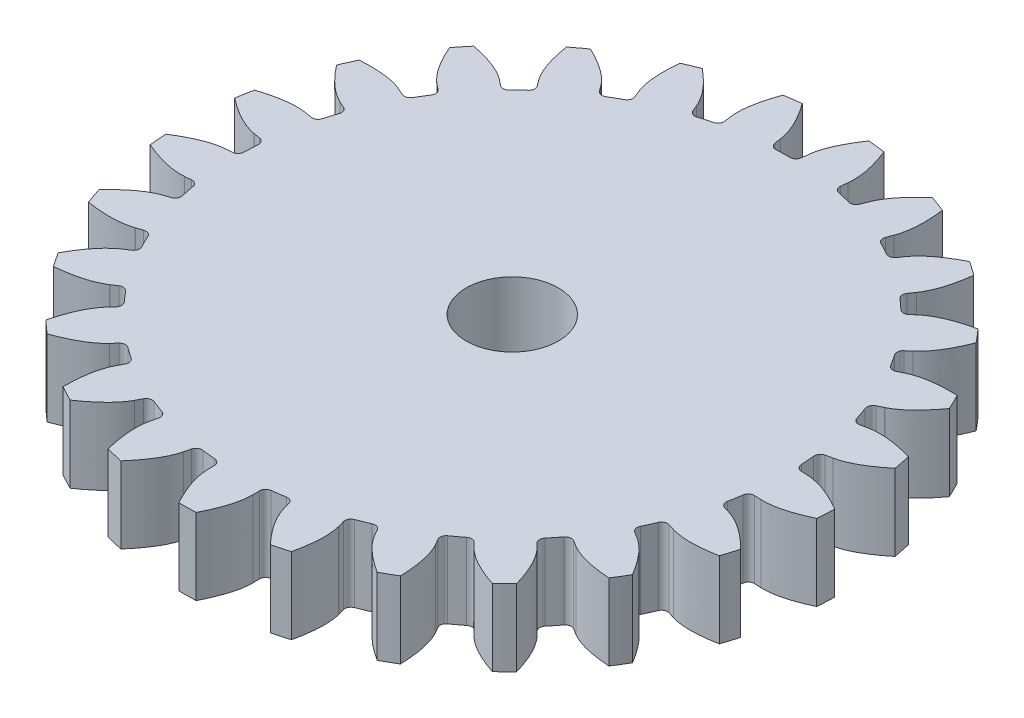
from build123d import *

# Parameters (mm, degrees)
BOSS_EXTRUDE2_DEPTH = 10
CIRPATTERN1_COUNT   = 25
SKETCH3_R           = 6.04294198
CUT_EXTRUDE1_DEPTH  = 10
FILLET1_R           = 0.8


with BuildPart() as part:
    # Sketch1 → Boss-Extrude2 (new body)
    with BuildSketch(Plane(origin=(0, 0, 0), x_dir=(1, 0, 0), z_dir=(0, 1, 0))):
        with BuildLine():
            add(Edge.make_bspline(
                [(26.633020463, 26.527161948), (26.749695792, 26.628801295), (26.879689147, 26.729652173), (27.012694679, 26.826141026), (27.020826293, 26.832015831)],
                knots=[0, 0, 0, 0, 0.040059088, 0.042663871, 0.042663871, 0.042663871, 0.042663871], degree=3))
            Line((26.633020463, 26.527161948), (25.4191383, 25.492497094))
            ThreePointArc((25.4191383, 25.492497094), (-27.397879726, -23.352862491), (29.197066656, 21.06018278))
            Line((29.197066656, 21.06018278), (30.410948819, 22.094847634))
            add(Edge.make_bspline(
                [(30.410948819, 22.094847634), (30.529786439, 22.193950153), (31.542274252, 23.14079114), (32.61415257, 24.887712007), (33.366991417, 26.583683765), (33.594353191, 27.159886482)],
                knots=[0, 0, 0, 0, 0.040059088, 0.359466749, 0.520253837, 0.520253837, 0.520253837, 0.520253837], degree=3))
            ThreePointArc((33.594353191, 27.159886482), (32.877455672, 28.023434989), (32.13836682, 28.868068487))
            add(Edge.make_bspline(
                [(32.13836682, 28.868068487), (31.533424415, 28.73484824), (29.749344528, 28.262732537), (28.009821823, 27.546530389), (27.020826293, 26.832015831)],
                knots=[0.188393437, 0.188393437, 0.188393437, 0.188393437, 0.349180525, 0.665983403, 0.665983403, 0.665983403, 0.665983403], degree=3))
        make_face()
    boss_extrude2 = extrude(amount=BOSS_EXTRUDE2_DEPTH)

    # CirPattern1: Boss-Extrude2 ×25 about axis
    cirpattern1_axis = Axis((0, 0, 0), (0, 1, 0))
    for i in range(1, CIRPATTERN1_COUNT):
        add(boss_extrude2.rotate(cirpattern1_axis, i * 360 / CIRPATTERN1_COUNT))

    # Sketch3 → Cut-Extrude1 (cut)
    with BuildSketch(Plane(origin=(0, 10, 0), x_dir=(1, 0, 0), z_dir=(0, 1, 0))):
        Circle(SKETCH3_R)
    extrude(amount=-CUT_EXTRUDE1_DEPTH, mode=Mode.SUBTRACT)

    # Fillet1
    fillet1_edges = [part.edges().sort_by_distance(p)[0] for p in [
        (23.960767775, 5, -28.963592796),
        (18.280823102, 5, -31.013086056),
        (19.199258239, 5, -32.317125229),
        (16.00504357, 5, -34.012448902),
        (9.993856557, 5, -34.585008763),
        (10.55913601, 5, -36.076484678),
        (7.043663615, 5, -36.924177755),
        (6.867058433, 5, -35.338980015),
        (1.078939249, 5, -35.983828175),
        (1.255544431, 5, -37.569025915),
        (-2.360295629, 5, -37.515824722),
        (-2.137129788, 5, -35.936508961),
        (-7.90377178, 5, -35.121651323),
        (-8.126937621, 5, -36.700967084),
        (-11.615948819, 5, -35.750214448),
        (-11.007034284, 5, -34.276014883),
        (-16.38985976, 5, -32.05265195),
        (-16.998774294, 5, -33.526851515),
        (-20.141729223, 5, -31.73828672),
        (-19.185326336, 5, -30.461832732),
        (-23.846112574, 5, -26.969666574),
        (-24.802515462, 5, -28.246120562),
        (-27.401930705, 5, -25.732125712),
        (-26.158133774, 5, -24.7336216),
        (-29.804026435, 5, -20.19207786),
        (-31.047823365, 5, -21.190581972),
        (-32.940368103, 5, -18.109120609),
        (-31.487329465, 5, -17.451306059),
        (-33.889243703, 5, -12.145746632),
        (-35.342282341, 5, -12.803561183),
        (-36.409041027, 5, -9.348252859),
        (-34.838060443, 5, -9.072460776),
        (-35.845075153, 5, -3.336253474),
        (-37.416055737, 5, -3.612045557),
        (-37.59, 5, 0),
        (-35.999787959, 5, -0.123559417),
        (-35.548628703, 5, 5.682868759),
        (-37.138840744, 5, 5.806428176),
        (-36.409041027, 5, 9.348252859),
        (-34.899516398, 5, 8.833105635),
        (-33.018531173, 5, 14.344915448),
        (-34.528055801, 5, 14.860062672),
        (-32.940368103, 5, 18.109120609),
        (-31.606379872, 5, 17.234754173),
        (-28.413757895, 5, 22.105618342),
        (-29.747746126, 5, 22.979984778),
        (-27.401930705, 5, 25.732125712),
        (-26.327298257, 5, 24.553479722),
        (-22.02364371, 5, 28.477343937),
        (-23.098276158, 5, 29.655989927),
        (-20.141729223, 5, 31.73828672),
        (-19.393975668, 5, 30.329419839),
        (-14.249702994, 5, 33.059733281),
        (-14.997456549, 5, 34.468600161),
        (-11.615948819, 5, 35.750214448),
        (-11.242058262, 5, 34.199650964),
        (-5.580401032, 5, 35.564857997),
        (-5.954291588, 5, 37.115421481),
        (-2.360295629, 5, 37.515824722),
        (-2.38376099, 5, 35.920992241),
        (3.439538051, 5, 35.835311886),
        (3.463003411, 5, 37.430144368),
        (7.043663615, 5, 36.924177755),
        (6.624316752, 5, 35.385285467),
        (12.243358307, 5, 33.854101337),
        (12.66270517, 5, 35.392993625),
        (16.00504357, 5, 34.012448902),
        (15.21616431, 5, 32.626191069),
        (20.277883334, 5, 29.745713094),
        (21.066762593, 5, 31.131970928),
        (23.960767775, 5, 28.963592796),
        (22.851924304, 5, 27.817073096),
        (27.038274374, 5, 23.768292301),
        (28.147117845, 5, 24.914812001),
        (30.410948819, 5, 22.094847634),
        (29.051813849, 5, 21.260106116),
        (32.099751195, 5, 16.297422288),
        (33.458886164, 5, 17.132163806),
        (34.950298105, 5, 13.837801935),
        (33.426271086, 5, 13.36728848),
        (35.144282594, 5, 7.802525296),
        (36.668309612, 5, 8.273038751),
        (37.293591622, 5, 4.71127625),
        (35.700432777, 5, 4.634554947),
        (35.980569465, 5, -1.182633057),
        (37.573728311, 5, -1.105911754),
        (37.293591622, 5, -4.71127625),
        (35.731404979, 5, -4.389384718),
        (34.55606483, 5, -10.093482225),
        (36.118251474, 5, -10.415373757),
        (34.950298105, 5, -13.837801935),
        (33.517241596, 5, -13.137523198),
        (30.960275554, 5, -18.370120784),
        (32.393332062, 5, -19.070399521),
        (30.410948819, 5, -22.094847634),
        (29.197066656, 5, -21.06018278),
        (25.4191383, 5, -25.492497094),
        (26.633020463, 5, -26.527161948),
        (15.439764117, 5, -32.520972987),
        (23.042332638, 5, -27.659553623),
    ]]
    fillet(fillet1_edges, radius=FILLET1_R)


solid = part.part
